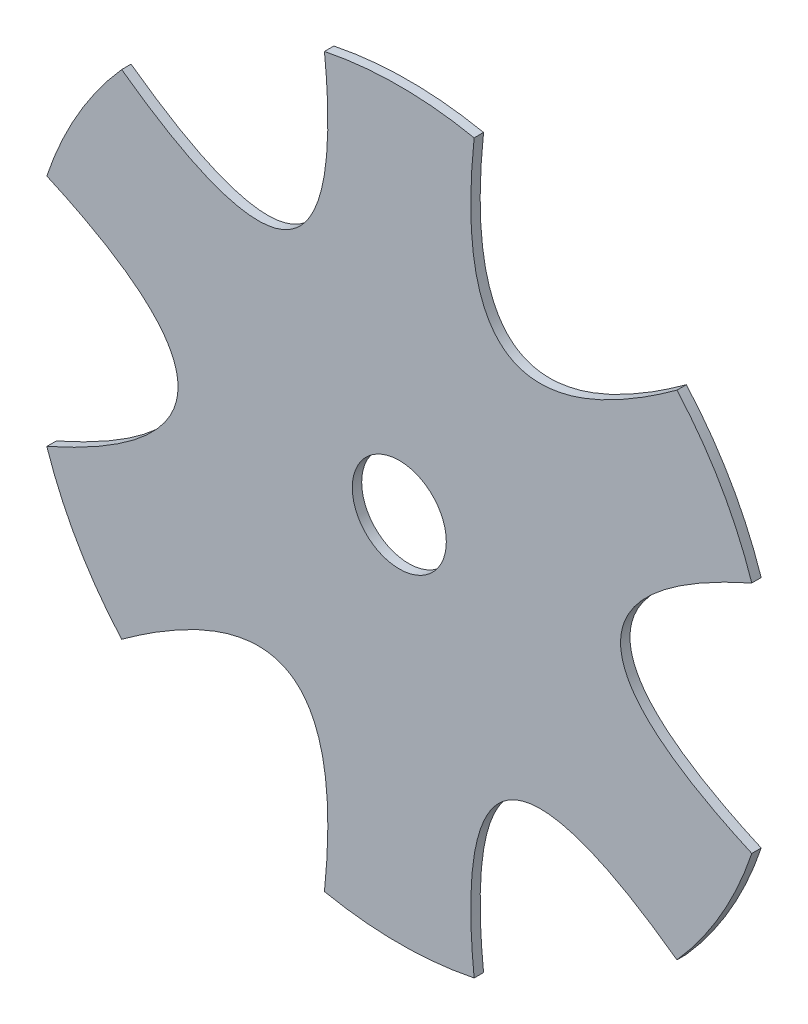
from build123d import *

# Parameters (mm, degrees)
SKETCH1_R           = 125.4125
BOSS_EXTRUDE1_DEPTH = 3.175
CUT_EXTRUDE1_DEPTH  = 178.388474647
CIRPATTERN1_COUNT   = 6
SKETCH3_R           = 15.875
CUT_EXTRUDE2_DEPTH  = 50.8


with BuildPart() as part:
    # Sketch1 → Boss-Extrude1 (new body)
    with BuildSketch(Plane.XY):
        Circle(SKETCH1_R)
    extrude(amount=BOSS_EXTRUDE1_DEPTH)

    # Sketch2 → Cut-Extrude1 (cut, through all)
    with BuildSketch(Plane.XY.offset(3.175)):
        with BuildLine():
            ThreePointArc((93.748147638, 83.304141377), (62.70625, 108.610410952), (25.269428854, 122.840348101))
            add(Edge.make_bspline(
                [(93.748147638, 83.304141377), (15.206576878, 26.338563761), (25.269428854, 122.840348101)],
                knots=[0, 0, 0, 1, 1, 1], degree=2))
        make_face()
    cut_extrude1 = extrude(amount=-CUT_EXTRUDE1_DEPTH, mode=Mode.SUBTRACT)

    # CirPattern1: Cut-Extrude1 ×6 about axis
    cirpattern1_axis = Axis((0, 0, 3.175), (0, 0, -1))
    for i in range(1, CIRPATTERN1_COUNT):
        add(cut_extrude1.rotate(cirpattern1_axis, i * 360 / CIRPATTERN1_COUNT), mode=Mode.SUBTRACT)

    # Sketch3 → Cut-Extrude2 (cut)
    with BuildSketch(Plane(origin=(0, 0, 0), x_dir=(-1, 0, 0), z_dir=(0, 0, -1))):
        Circle(SKETCH3_R)
    extrude(amount=-CUT_EXTRUDE2_DEPTH, mode=Mode.SUBTRACT)


solid = part.part
